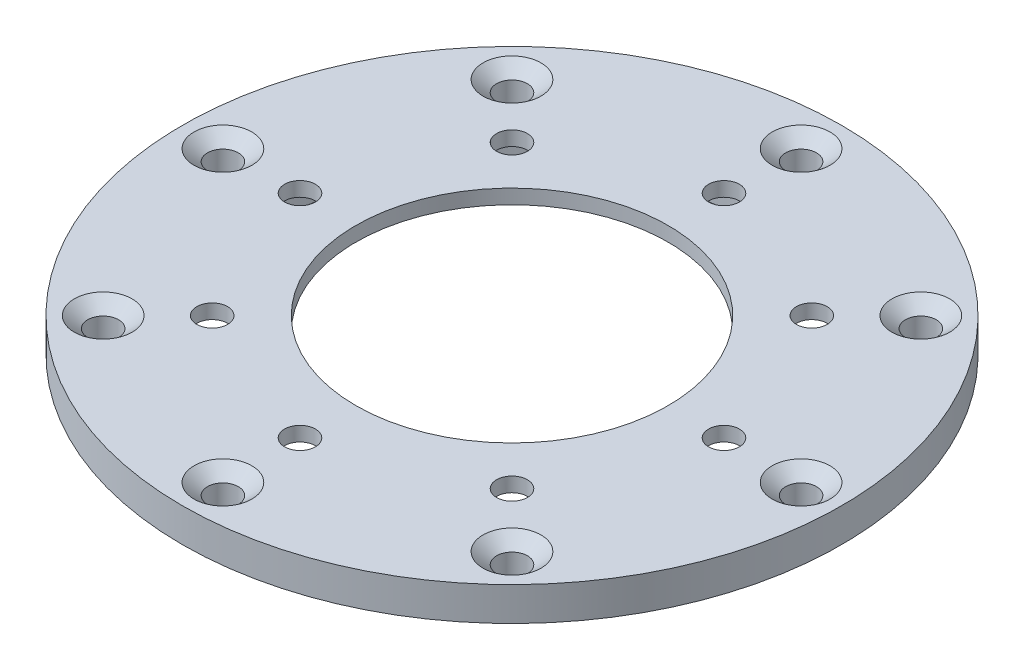
from build123d import *

# Parameters (mm, degrees)
ESQUISSE3_R                                    = 1.6
ENL_V_MAT_EXTRU_1_DEPTH                        = 49.492576751
FRAISAGE_POUR_VIS_T_TE_FRAIS_E_100_D           = 3.2
FRAISAGE_POUR_VIS_T_TE_FRAIS_E_100_CSINK_D     = 6
FRAISAGE_POUR_VIS_T_TE_FRAIS_E_100_CSINK_ANGLE = 100
R_P_TITION_CIRCULAIRE1_COUNT                   = 8


with BuildPart() as part:
    # Esquisse2 → Révolution1 (revolve)
    with BuildSketch(Plane.XY):
        Polygon((34.2, 0), (34.2, 3.5), (16.2, 3.5), (16.2, 2), (24.2, 2), (24.2, 0), align=None)
    revolve(axis=Axis((0, 37.373365456, 0), (0, -1, 0)))

    # Esquisse3 → Enlèv. mat.-Extru.1 (cut, through all)
    with BuildSketch(Plane(origin=(0, 3.5, 0), x_dir=(1, 0, 0), z_dir=(0, 1, 0))):
        with Locations((22, 0)):
            Circle(ESQUISSE3_R)
    enl_v_mat_extru_1 = extrude(amount=-ENL_V_MAT_EXTRU_1_DEPTH, mode=Mode.SUBTRACT)

    # Fraisage pour vis à tête fraisée (100) #01 (through all)
    with Locations(Plane(origin=(0, 3.5, 0), x_dir=(1, 0, 0), z_dir=(0, 1, 0))):
        with Locations((30, 0)):
            fraisage_pour_vis_t_te_frais_e_100 = CounterSinkHole(FRAISAGE_POUR_VIS_T_TE_FRAIS_E_100_D / 2, FRAISAGE_POUR_VIS_T_TE_FRAIS_E_100_CSINK_D / 2, counter_sink_angle=FRAISAGE_POUR_VIS_T_TE_FRAIS_E_100_CSINK_ANGLE)

    # Répétition circulaire1: Enlèv. mat.-Extru.1, Fraisage pour vis à tête fraisée (100) #01 ×8 about axis
    r_p_tition_circulaire1_axis = Axis((0, 37.373365456, 0), (0, -1, 0))
    add([enl_v_mat_extru_1.rotate(r_p_tition_circulaire1_axis, i * 360 / R_P_TITION_CIRCULAIRE1_COUNT) for i in range(1, R_P_TITION_CIRCULAIRE1_COUNT)], mode=Mode.SUBTRACT)
    add([fraisage_pour_vis_t_te_frais_e_100.rotate(r_p_tition_circulaire1_axis, i * 360 / R_P_TITION_CIRCULAIRE1_COUNT) for i in range(1, R_P_TITION_CIRCULAIRE1_COUNT)], mode=Mode.SUBTRACT)


solid = part.part
